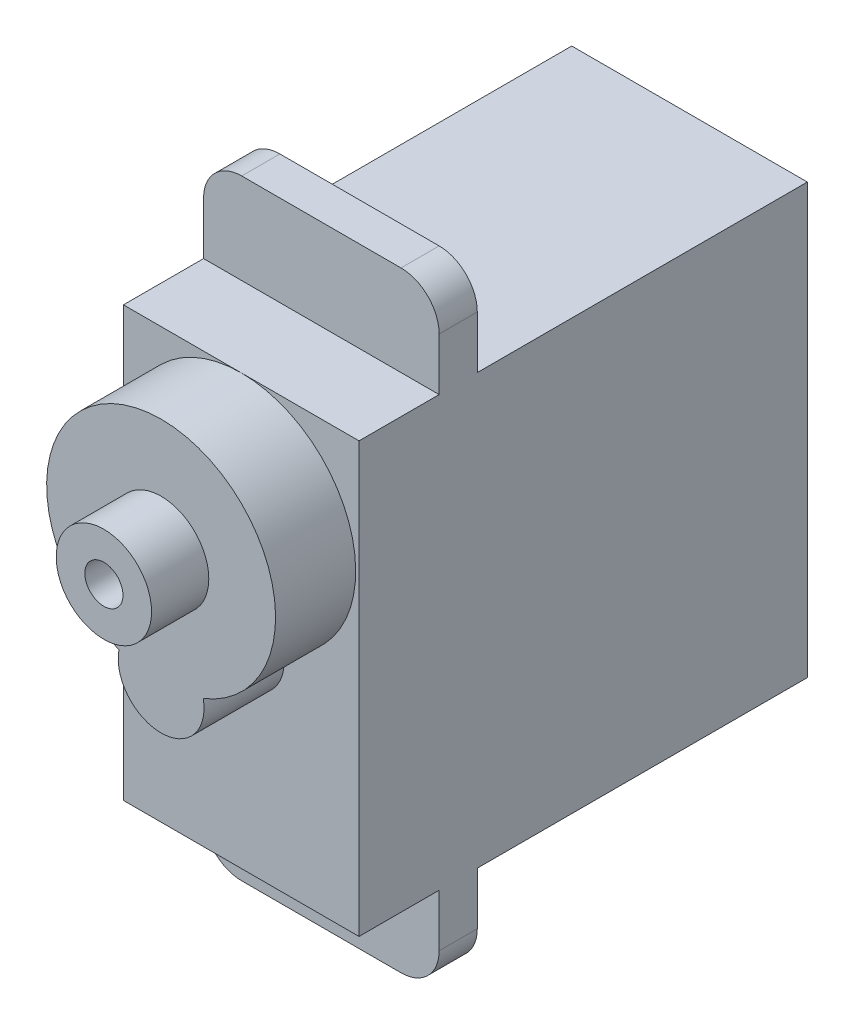
from build123d import *

# Parameters (mm, degrees)
SKETCH3_W           = 22.5
SKETCH3_H           = 23.5
BOSS_EXTRUDE1_DEPTH = 6.175
SKETCH4_W           = 12.35
SKETCH4_H           = 32
BOSS_EXTRUDE2_DEPTH = 2
BOSS_EXTRUDE3_DEPTH = 4.2
SKETCH6_R           = 2.5
CUT_EXTRUDE1_DEPTH  = 4.2
FILLET1_R           = 2
BOSS_EXTRUDE4_START = 7.2
SKETCH7_R           = 2.5
BOSS_EXTRUDE4_DEPTH = 7.2
SKETCH8_R           = 1
CUT_EXTRUDE2_DEPTH  = 7


with BuildPart() as part:
    # Sketch3 → Boss-Extrude1 (new, symmetric)
    with BuildSketch(Plane(origin=(0, -28.275548605, 0), x_dir=(0, 1, 0), z_dir=(1, 0, 0))):
        with Locations((24.609729517, 167.116706922)):
            Rectangle(SKETCH3_W, SKETCH3_H)
    extrude(amount=BOSS_EXTRUDE1_DEPTH, both=True)

    # Sketch4 → Boss-Extrude2 (add)
    with BuildSketch(Plane.XY.offset(174.666706922)):
        with Locations((0, -3.665819089)):
            Rectangle(SKETCH4_W, SKETCH4_H)
    extrude(amount=-BOSS_EXTRUDE2_DEPTH)

    # Sketch5 → Boss-Extrude3 (add)
    with BuildSketch(Plane.XY.offset(178.866706922)):
        with BuildLine():
            ThreePointArc((2.210095356, -3.993944089), (0, 7.584180911), (-2.210095356, -3.993944089))
            ThreePointArc((-2.210095356, -3.993944089), (0, -6.665819089), (2.210095356, -3.993944089))
        make_face()
    extrude(amount=BOSS_EXTRUDE3_DEPTH)

    # Sketch6 → Cut-Extrude1 (cut)
    with BuildSketch(Plane.XY.offset(183.066706922)):
        with Locations((0, 1.584180911)):
            Circle(SKETCH6_R)
    extrude(amount=-CUT_EXTRUDE1_DEPTH, mode=Mode.SUBTRACT)

    # Fillet1
    fillet1_edges = [part.edges().sort_by_distance(p)[0] for p in [
        (6.175, -19.665819089, 173.666706922),
        (-6.175, -19.665819089, 173.666706922),
        (6.175, 12.334180911, 173.666706922),
        (-6.175, 12.334180911, 173.666706922),
    ]]
    fillet(fillet1_edges, radius=FILLET1_R)

    # Sketch7 → Boss-Extrude4 (add)
    with BuildSketch(Plane.XY.offset(178.866706922).offset(BOSS_EXTRUDE4_START)):
        with Locations((0, 1.584180911)):
            Circle(SKETCH7_R)
    extrude(amount=-BOSS_EXTRUDE4_DEPTH)

    # Sketch8 → Cut-Extrude2 (cut)
    with BuildSketch(Plane.XY.offset(186.066706922)):
        with Locations((0, 1.584180911)):
            Circle(SKETCH8_R)
    extrude(amount=-CUT_EXTRUDE2_DEPTH, mode=Mode.SUBTRACT)


solid = part.part
